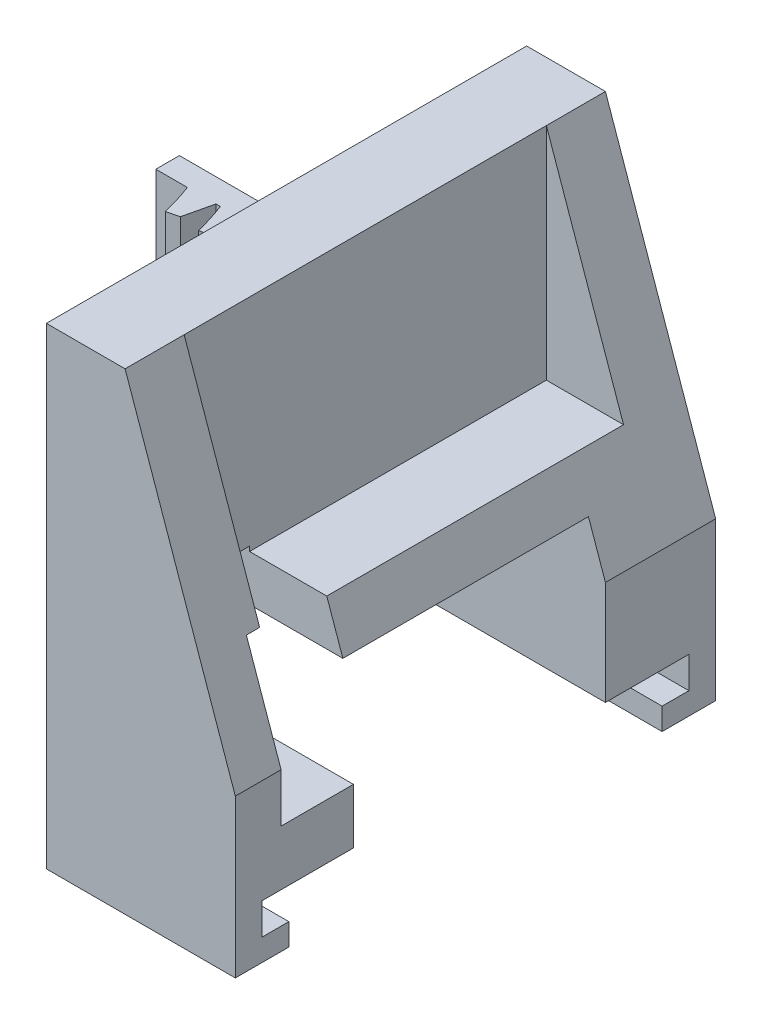
from build123d import *

# Parameters (mm, degrees)
BOSS_EXTRUDE1_DEPTH = 30.5
SKETCH4_W           = 16
SKETCH4_H           = 14
CUT_EXTRUDE2_DEPTH  = 25
CUT_EXTRUDE4_DEPTH  = 11.5
BOSS_EXTRUDE2_DEPTH = 8
SKETCH8_W           = 5
SKETCH8_H           = 9.4
CUT_EXTRUDE5_DEPTH  = 47.810789355
CUT_EXTRUDE6_DEPTH  = 47.810789355


with BuildPart() as part:
    # Sketch1 → Boss-Extrude1 (new body)
    with BuildSketch(Plane.XY):
        Polygon((0, 0), (0, -30), (12, -30), (12, -20), (5, 0), align=None)
    extrude(amount=-BOSS_EXTRUDE1_DEPTH)

    # Sketch4 → Cut-Extrude2 (cut)
    with BuildSketch(Plane.ZY):
        with Locations((-15.5, -23.917856259)):
            Rectangle(SKETCH4_W, SKETCH4_H)
    extrude(amount=-CUT_EXTRUDE2_DEPTH, mode=Mode.SUBTRACT)

    # Sketch6 → Cut-Extrude4 (cut, symmetric)
    with BuildSketch(Plane.XY.offset(-15.25)):
        Polygon((5, 0), (5, -14), (9.9, -14), align=None)
    extrude(amount=CUT_EXTRUDE4_DEPTH, both=True, mode=Mode.SUBTRACT)

    # Sketch7 → Boss-Extrude2 (add)
    with BuildSketch(Plane(origin=(0, -22, 0), x_dir=(1, 0, 0), z_dir=(0, 1, 0))):
        with BuildLine():
            Line((0, 27.45), (-19, 27.45))
            Line((-19, 27.45), (-19, 25.95))
            Line((-19, 25.95), (-16.993455994, 25.95))
            ThreePointArc((-16.993455994, 25.95), (-16.650158075, 24.947892846), (-16.365476207, 23.927584833))
            Line((-16.365476207, 23.927584833), (-15.609396851, 24.115112691))
            Line((-15.609396851, 24.115112691), (-15.179008189, 25.95))
            Line((-15.179008189, 25.95), (-14.896454824, 25.95))
            ThreePointArc((-14.896454824, 25.95), (-14.553156905, 24.947892846), (-14.268475038, 23.927584833))
            Line((-14.268475038, 23.927584833), (-13.512395681, 24.115112691))
            Line((-13.512395681, 24.115112691), (-13.082007019, 25.95))
            Line((-13.082007019, 25.95), (-12.799453654, 25.95))
            ThreePointArc((-12.799453654, 25.95), (-12.456155735, 24.947892846), (-12.171473868, 23.927584833))
            Line((-12.171473868, 23.927584833), (-11.415394512, 24.115112691))
            Line((-11.415394512, 24.115112691), (-10.985005849, 25.95))
            Line((-10.985005849, 25.95), (-10.702452484, 25.95))
            ThreePointArc((-10.702452484, 25.95), (-10.359154566, 24.947892846), (-10.074472698, 23.927584833))
            Line((-10.074472698, 23.927584833), (-9.318393342, 24.115112691))
            Line((-9.318393342, 24.115112691), (-8.888004679, 25.95))
            Line((-8.888004679, 25.95), (-8.605451315, 25.95))
            ThreePointArc((-8.605451315, 25.95), (-8.262153396, 24.947892846), (-7.977471528, 23.927584833))
            Line((-7.977471528, 23.927584833), (-7.221392172, 24.115112691))
            Line((-7.221392172, 24.115112691), (-6.791003509, 25.95))
            Line((-6.791003509, 25.95), (-6.508450145, 25.95))
            ThreePointArc((-6.508450145, 25.95), (-6.165152226, 24.947892846), (-5.880470358, 23.927584833))
            Line((-5.880470358, 23.927584833), (-5.124391002, 24.115112691))
            Line((-5.124391002, 24.115112691), (-4.69400234, 25.95))
            Line((-4.69400234, 25.95), (-4.411448975, 25.95))
            ThreePointArc((-4.411448975, 25.95), (-4.068151056, 24.947892846), (-3.783469189, 23.927584833))
            Line((-3.783469189, 23.927584833), (-3.027389832, 24.115112691))
            Line((-3.027389832, 24.115112691), (-2.59700117, 25.95))
            Line((-2.59700117, 25.95), (-2.314447805, 25.95))
            ThreePointArc((-2.314447805, 25.95), (-1.971149886, 24.947892846), (-1.686468019, 23.927584833))
            Line((-1.686468019, 23.927584833), (-0.930388662, 24.115112691))
            Line((-0.930388662, 24.115112691), (-0.5, 25.95))
            Line((-0.5, 25.95), (0, 25.95))
            Line((0, 25.95), (0, 27.45))
        make_face()
    extrude(amount=BOSS_EXTRUDE2_DEPTH)

    # Sketch8 → Cut-Extrude5 (cut, through all)
    with BuildSketch(Plane.ZY):
        with Locations((-5.406815523, -18.4)):
            Rectangle(SKETCH8_W, SKETCH8_H)
    extrude(amount=-CUT_EXTRUDE5_DEPTH, mode=Mode.SUBTRACT)

    # Sketch9 → Cut-Extrude6 (cut, through all)
    with BuildSketch(Plane.ZY):
        Polygon((-7.5, -26.6), (-1.7, -26.6), (-1.7, -28.6), (-3.4, -28.6), (-3.4, -30.296685761), (-7.5, -30.296685761), align=None)
        Polygon((-23, -30.296685761), (-23, -26.6), (-28.8, -26.6), (-28.8, -28.6), (-27.1, -28.6), (-27.1, -30.296685761), align=None)
    extrude(amount=-CUT_EXTRUDE6_DEPTH, mode=Mode.SUBTRACT)


solid = part.part
